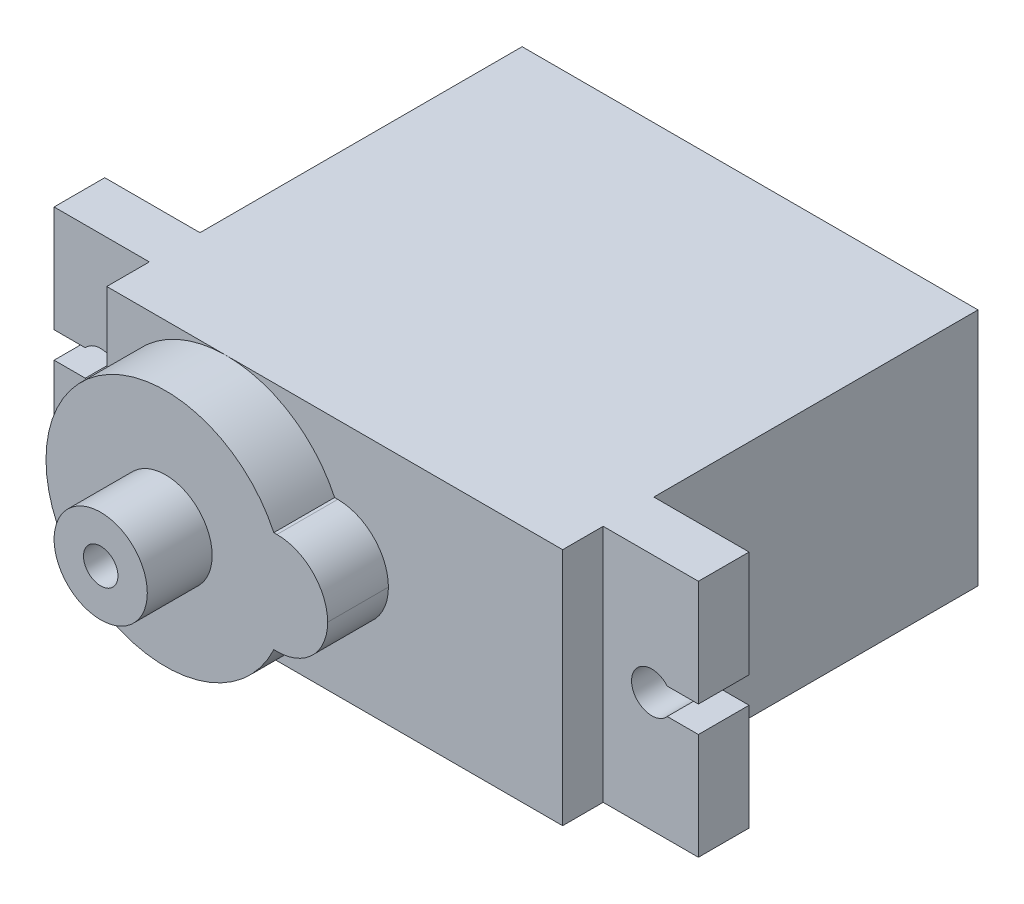
from build123d import *

# Parameters (mm, degrees)
SKETCH1_W           = 22.5
SKETCH1_H           = 11.8
BOSS_EXTRUDE1_DEPTH = 26.7
SKETCH2_W           = 2.5
SKETCH2_H           = 11.8
BOSS_EXTRUDE2_DEPTH = 4.7
SKETCH5_W           = 2.5
SKETCH5_H           = 11.8
BOSS_EXTRUDE3_DEPTH = 4.7
CUT_EXTRUDE1_DEPTH  = 6.2
FILLET1_R           = 2.5
FILLET2_R           = 2.5
CUT_EXTRUDE2_DEPTH  = 3.2
SKETCH7_R           = 2.3
SKETCH7_R_2         = 0.85
BOSS_EXTRUDE4_DEPTH = 3.2
CUT_EXTRUDE3_DEPTH  = 2.5
CUT_EXTRUDE4_DEPTH  = 2.5


with BuildPart() as part:
    # Sketch1 → Boss-Extrude1 (new body)
    with BuildSketch(Plane.XY):
        with Locations((3.150909091, 4.478636364)):
            Rectangle(SKETCH1_W, SKETCH1_H)
    extrude(amount=BOSS_EXTRUDE1_DEPTH)

    # Sketch2 → Boss-Extrude2 (add)
    with BuildSketch(Plane(origin=(14.400909091, 0, 0), x_dir=(0, 0, -1), z_dir=(1, 0, 0))):
        with Locations((-17.25, 4.478636364)):
            Rectangle(SKETCH2_W, SKETCH2_H)
    extrude(amount=BOSS_EXTRUDE2_DEPTH)

    # Sketch5 → Boss-Extrude3 (add)
    with BuildSketch(Plane.ZY.offset(8.099090909)):
        with Locations((17.15, 4.478636364)):
            Rectangle(SKETCH5_W, SKETCH5_H)
    extrude(amount=BOSS_EXTRUDE3_DEPTH)

    # Sketch6 → Cut-Extrude1 (cut)
    with BuildSketch(Plane.XY.offset(26.7)):
        with BuildLine():
            Line((5.800909091, 1.978636364), (3.145064777, 1.978636364))
            ThreePointArc((3.145064777, 1.978636364), (0.967926621, -0.499315019), (-2.199090896, -1.421363636))
            Line((-2.199090896, -1.421363636), (14.400909091, -1.421363636))
            Line((14.400909091, -1.421363636), (14.400909091, 10.378636364))
            Line((14.400909091, 10.378636364), (-2.199090917, 10.378636364))
            ThreePointArc((-2.199090917, 10.378636364), (0.967926612, 9.456587752), (3.145064777, 6.978636364))
            Line((3.145064777, 6.978636364), (5.800909091, 6.978636364))
            Line((5.800909091, 6.978636364), (5.800909091, 1.978636364))
        make_face()
        with BuildLine():
            Line((-8.099090909, -1.421363636), (-2.199090896, -1.421363636))
            ThreePointArc((-2.199090896, -1.421363636), (-6.371020914, 0.30670635), (-8.099090909, 4.478636364))
            Line((-8.099090909, 4.478636364), (-8.099090909, -1.421363636))
        make_face()
        with BuildLine():
            Line((-8.099090909, 10.378636364), (-8.099090909, 4.478636364))
            ThreePointArc((-8.099090909, 4.478636364), (-6.371020921, 8.65056637), (-2.199090917, 10.378636364))
            Line((-2.199090917, 10.378636364), (-8.099090909, 10.378636364))
        make_face()
    extrude(amount=-CUT_EXTRUDE1_DEPTH, mode=Mode.SUBTRACT)

    # Fillet1
    fillet1_edges = [part.edges().sort_by_distance(p)[0] for p in [
        (5.800909091, 1.978636364, 23.6),
    ]]
    fillet(fillet1_edges, radius=FILLET1_R)

    # Fillet2
    fillet2_edges = [part.edges().sort_by_distance(p)[0] for p in [
        (5.800909091, 6.978636364, 23.6),
    ]]
    fillet(fillet2_edges, radius=FILLET2_R - 0.0001)  # a hair under: the kernel refuses the full size

    # Sketch6<3> → Cut-Extrude2 (cut)
    with BuildSketch(Plane.XY.offset(26.7)):
        with BuildLine():
            Line((3.145064777, 1.978636364), (5.800909091, 1.978636364))
            Line((5.800909091, 1.978636364), (5.800909091, 6.978636364))
            Line((5.800909091, 6.978636364), (3.145064777, 6.978636364))
            ThreePointArc((3.145064777, 6.978636364), (-8.099090909, 4.478636364), (3.145064777, 1.978636364))
        make_face()
    extrude(amount=-CUT_EXTRUDE2_DEPTH, mode=Mode.SUBTRACT)

    # Sketch7 → Boss-Extrude4 (add)
    with BuildSketch(Plane.XY.offset(23.5)):
        with Locations((-2.199090909, 4.478636364)):
            Circle(SKETCH7_R)
        with Locations((-2.199090909, 4.478636364)):
            Circle(SKETCH7_R_2, mode=Mode.SUBTRACT)
    extrude(amount=BOSS_EXTRUDE4_DEPTH)

    # Sketch11 → Cut-Extrude3 (cut)
    with BuildSketch(Plane.XY.offset(18.4)):
        with BuildLine():
            Line((-12.865758951, 3.828636364), (-11.259025117, 3.828636364))
            ThreePointArc((-11.259025117, 3.828636364), (-9.499090909, 4.478636364), (-11.259025117, 5.128636364))
            Line((-11.259025117, 5.128636364), (-12.865758951, 5.128636364))
            Line((-12.865758951, 5.128636364), (-12.865758951, 3.828636364))
        make_face()
    extrude(amount=-CUT_EXTRUDE3_DEPTH, mode=Mode.SUBTRACT)

    # Sketch12 → Cut-Extrude4 (cut)
    with BuildSketch(Plane.XY.offset(18.5)):
        with BuildLine():
            Line((17.560843299, 3.828636364), (19.100909091, 3.828636364))
            Line((19.100909091, 3.828636364), (19.100909091, 5.128636364))
            Line((19.100909091, 5.128636364), (17.560843299, 5.128636364))
            ThreePointArc((17.560843299, 5.128636364), (15.800909091, 4.478636364), (17.560843299, 3.828636364))
        make_face()
    extrude(amount=-CUT_EXTRUDE4_DEPTH, mode=Mode.SUBTRACT)


solid = part.part
